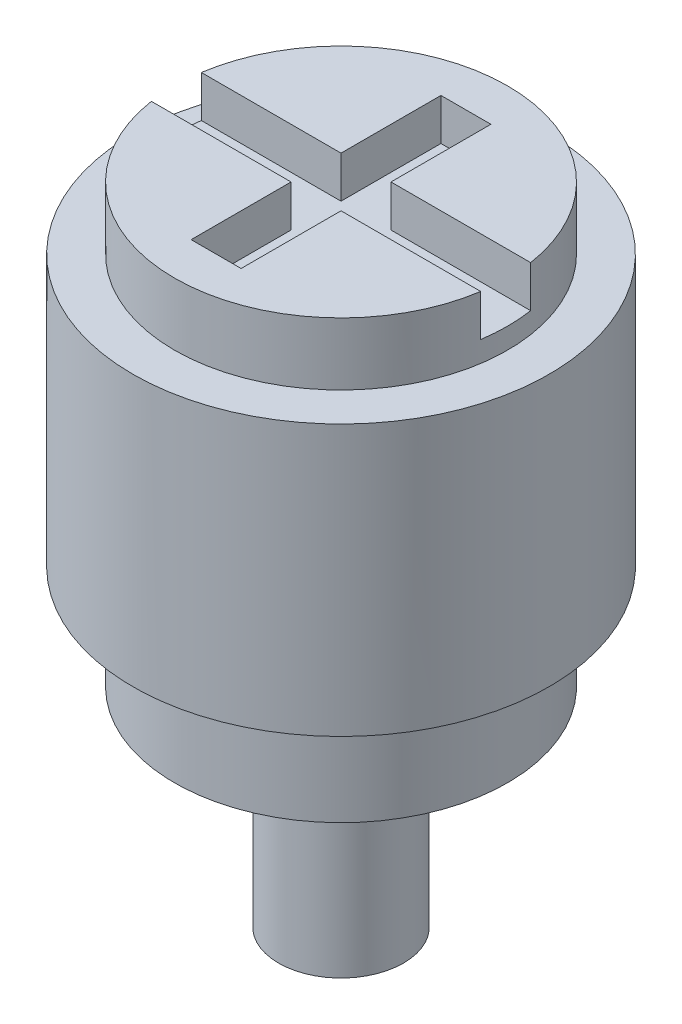
from build123d import *

# Parameters (mm, degrees)
SKETCH_1_R          = 1.5
EXTRUDE_1_DEPTH     = 5
SKETCH_6_R          = 5
EXTRUDE_1_2_DEPTH   = 9
SKETCH_2_R          = 4
EXTRUDE_2_DEPTH     = 1.5
SKETCH_3_W          = 8.364260008
SKETCH_3_H          = 1.2
CUT_EXTRUDE_1_DEPTH = 1
SKETCH_4_W          = 1.2
SKETCH_4_H          = 6
CUT_EXTRUDE_2_DEPTH = 1
SKETCH_7_R          = 3
SKETCH_7_R_2        = 1.5
CUT_EXTRUDE_3_DEPTH = 2
SKETCH_8_OUTSIDE_W  = 16.196
SKETCH_8_OUTSIDE_H  = 16.196
SKETCH_8_OUTSIDE_R  = 4
CUT_EXTRUDE_4_DEPTH = 2.5


with BuildPart() as part:
    # 草图1 → Extrude 1 (new body)
    with BuildSketch(Plane(origin=(0, 0, 0), x_dir=(1, 0, 0), z_dir=(0, 1, 0))):
        Circle(SKETCH_1_R)
    extrude(amount=EXTRUDE_1_DEPTH)

    # 草图6 → Extrude 1 2 (add)
    with BuildSketch(Plane(origin=(0, 5, 0), x_dir=(1, 0, 0), z_dir=(0, 1, 0))):
        Circle(SKETCH_6_R)
    extrude(amount=EXTRUDE_1_2_DEPTH)

    # 草图2 → 拉伸2 (add)
    with BuildSketch(Plane(origin=(0, 14, 0), x_dir=(-1, 0, 0), z_dir=(0, 1, 0))):
        Circle(SKETCH_2_R)
    extrude(amount=EXTRUDE_2_DEPTH)

    # 草图3 → 切除-拉伸1 (cut)
    with BuildSketch(Plane(origin=(0, 15.5, 0), x_dir=(-1, 0, 0), z_dir=(0, 1, 0))):
        Rectangle(SKETCH_3_W, SKETCH_3_H)
    extrude(amount=-CUT_EXTRUDE_1_DEPTH, mode=Mode.SUBTRACT)

    # 草图4 → 切除-拉伸2 (cut)
    with BuildSketch(Plane(origin=(0, 15.5, 0), x_dir=(-1, 0, 0), z_dir=(0, 1, 0))):
        Rectangle(SKETCH_4_W, SKETCH_4_H)
    extrude(amount=-CUT_EXTRUDE_2_DEPTH, mode=Mode.SUBTRACT)

    # 草图7 → 切除-拉伸3 (cut)
    with BuildSketch(Plane.XZ.offset(-5)):
        Circle(SKETCH_7_R)
        Circle(SKETCH_7_R_2, mode=Mode.SUBTRACT)
    extrude(amount=-CUT_EXTRUDE_3_DEPTH, mode=Mode.SUBTRACT)

    # 草图8 outside → 切除-拉伸4 (cut)
    with BuildSketch(Plane(origin=(0, 5, 0), x_dir=(-1, 0, 0), z_dir=(0, -1, 0))):
        Rectangle(SKETCH_8_OUTSIDE_W, SKETCH_8_OUTSIDE_H)
        Circle(SKETCH_8_OUTSIDE_R, mode=Mode.SUBTRACT)
    extrude(amount=-CUT_EXTRUDE_4_DEPTH, mode=Mode.SUBTRACT)


solid = part.part
